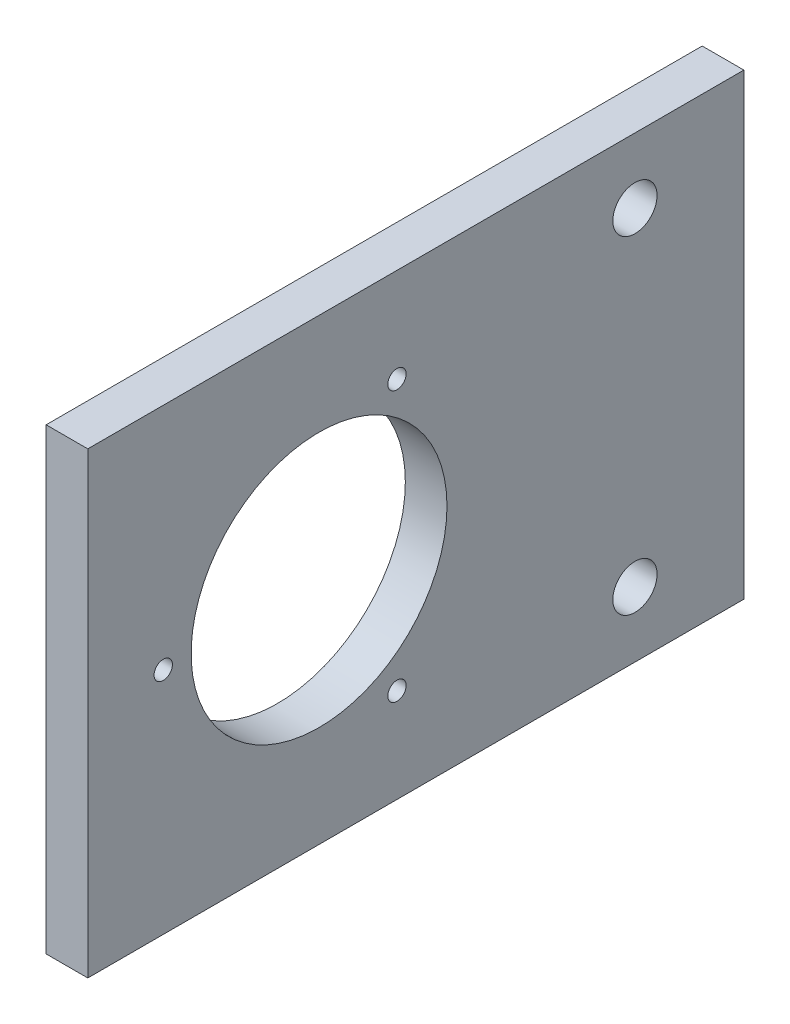
from build123d import *

# Parameters (mm, degrees)
SKETCH1_W           = 69.85
SKETCH1_H           = 100
SKETCH1_R           = 19.5
SKETCH1_R_2         = 3.37312
SKETCH1_R_3         = 1.4
BOSS_EXTRUDE1_DEPTH = 6.35


with BuildPart() as part:
    # Sketch1 → Boss-Extrude1 (new body)
    with BuildSketch(Plane.YZ):
        Rectangle(SKETCH1_W, SKETCH1_H)
        with Locations((0, 14.75)):
            Circle(SKETCH1_R, mode=Mode.SUBTRACT)
        with Locations((-25, -33.4)):
            Circle(SKETCH1_R_2, mode=Mode.SUBTRACT)
        with Locations((25, -33.4)):
            Circle(SKETCH1_R_2, mode=Mode.SUBTRACT)
        with Locations((0, 38.5)):
            Circle(SKETCH1_R_3, mode=Mode.SUBTRACT)
        with Locations((20.56810334, 2.875)):
            Circle(SKETCH1_R_3, mode=Mode.SUBTRACT)
        with Locations((-20.56810334, 2.875)):
            Circle(SKETCH1_R_3, mode=Mode.SUBTRACT)
    extrude(amount=BOSS_EXTRUDE1_DEPTH)


solid = part.part
